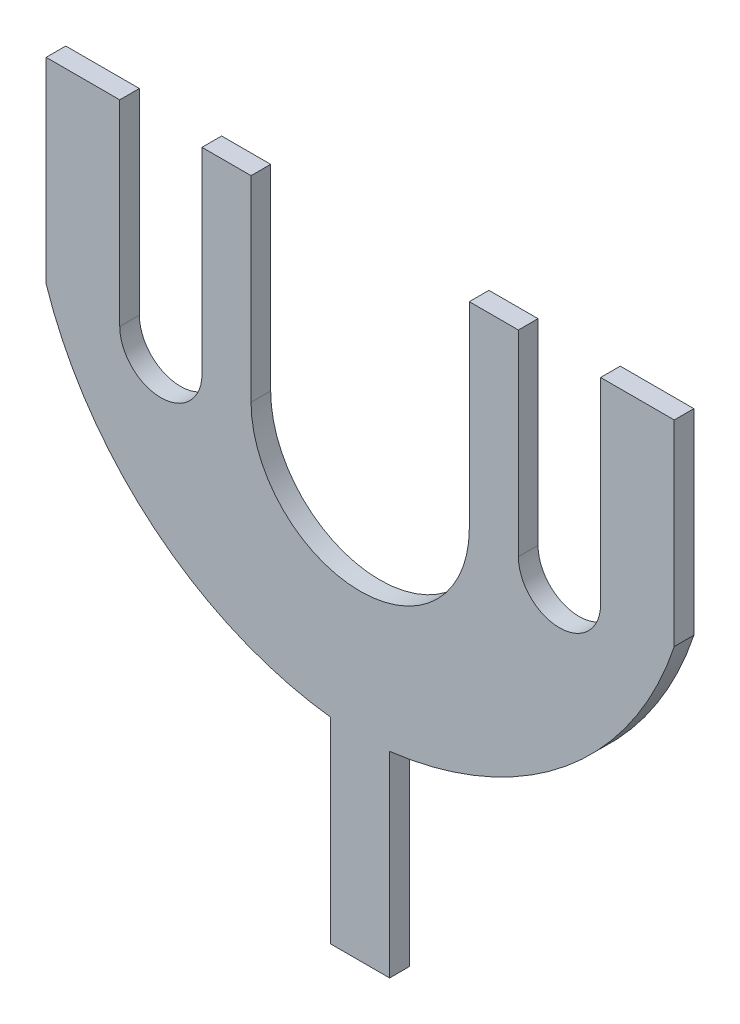
from build123d import *

# Parameters (mm, degrees)
BOSS_EXTRUDE2_DEPTH = 1


with BuildPart() as part:
    # Sketch2 → Boss-Extrude2 (new body)
    with BuildSketch(Plane.XY):
        with BuildLine():
            Line((-21, 21.487770019), (-17.25, 21.487770019))
            Line((-17.25, 21.487770019), (-17.25, 11.487770019))
            ThreePointArc((-17.25, 11.487770019), (-15.155, 9.392770019), (-13.06, 11.487770019))
            Line((-13.06, 11.487770019), (-13.06, 21.487770019))
            Line((-13.06, 21.487770019), (-10.56, 21.487770019))
            Line((-10.56, 21.487770019), (-10.56, 11.487770019))
            ThreePointArc((-10.56, 11.487770019), (-5, 5.927770019), (0.56, 11.487770019))
            Line((0.56, 11.487770019), (0.56, 21.487770019))
            Line((0.56, 21.487770019), (3.06, 21.487770019))
            Line((3.06, 21.487770019), (3.06, 11.487770019))
            ThreePointArc((3.06, 11.487770019), (5.155, 9.392770019), (7.25, 11.487770019))
            Line((7.25, 11.487770019), (7.25, 21.487770019))
            Line((7.25, 21.487770019), (11, 21.487770019))
            Line((11, 21.487770019), (11, 11.487770019))
            ThreePointArc((11, 11.487770019), (5.473055901, 3.447316855), (-3.5, -0.384166662))
            Line((-3.5, -0.384166662), (-3.5, -10.384166662))
            Line((-3.5, -10.384166662), (-6.5, -10.384166662))
            Line((-6.5, -10.384166662), (-6.5, -0.384166662))
            ThreePointArc((-6.5, -0.384166662), (-15.473055901, 3.447316855), (-21, 11.487770019))
            Line((-21, 11.487770019), (-21, 21.487770019))
        make_face()
    extrude(amount=BOSS_EXTRUDE2_DEPTH)


solid = part.part
